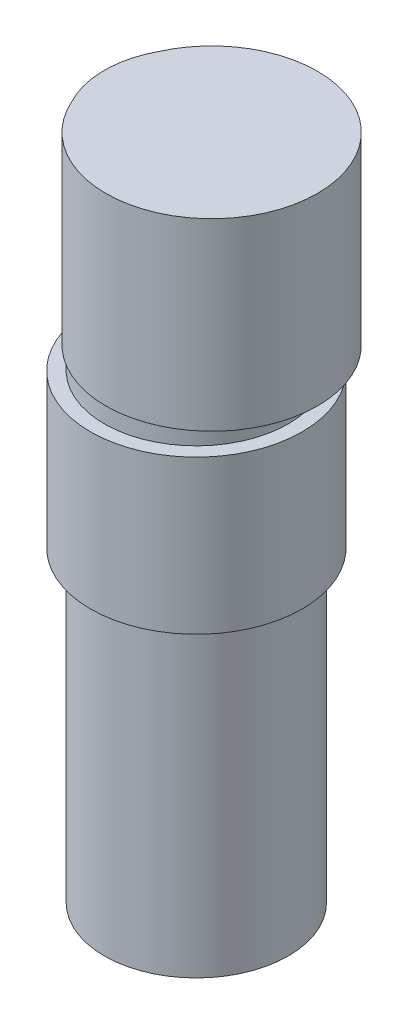
from build123d import *

# Parameters (mm, degrees)
SKETCH1_R                = 3.45
BOSS_EXTRUDE1_DEPTH      = 6
BOSS_EXTRUDE2_DEPTH      = 1
BOSS_EXTRUDE2_DEPTH_BACK = 4
SKETCH2_R                = 3.45
SKETCH3_R                = 3
BOSS_EXTRUDE4_DEPTH      = 22


with BuildPart() as part:
    # Sketch1 → Boss-Extrude1 (new body)
    with BuildSketch(Plane(origin=(0, 0, 0), x_dir=(1, 0, 0), z_dir=(0, 1, 0))):
        Circle(SKETCH1_R)
    extrude(amount=BOSS_EXTRUDE1_DEPTH)



with BuildPart() as body_2:
    # Sketch2 → Boss-Extrude2 (new, two sides: drawn at the far end of the back side and taken through both)
    with BuildSketch(Plane.XZ.offset(4.98).offset(-BOSS_EXTRUDE2_DEPTH_BACK)):
        with Locations((-0.5, 0)):
            Circle(SKETCH2_R)
    extrude(amount=BOSS_EXTRUDE2_DEPTH + BOSS_EXTRUDE2_DEPTH_BACK)


with BuildPart() as part_1:
    add(part.part)

    add(body_2.part)  # Boss-Extrude4 merges body 2
    # Sketch3 → Boss-Extrude4 (add)
    with BuildSketch(Plane(origin=(0, 6, 0), x_dir=(1, 0, 0), z_dir=(0, 1, 0))):
        with Locations((-0.5, 0)):
            Circle(SKETCH3_R)
    extrude(amount=-BOSS_EXTRUDE4_DEPTH)


solid = part_1.part
